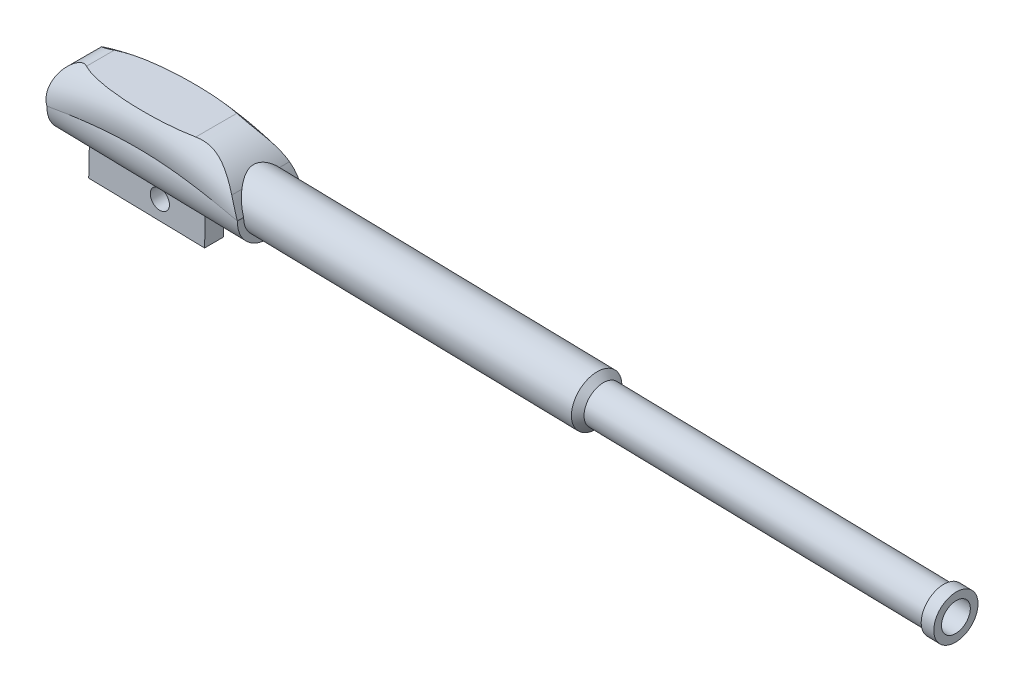
from build123d import *

# Parameters (mm, degrees)
SWEEP2_PROFILE_R                = 250
CUT_EXTRUDE4_DEPTH              = 21837.843425545
CUT_EXTRUDE4_DEPTH_BACK         = 21837.843425545
CUT_EXTRUDE5_START              = 4000
SKETCH746_W                     = 1580.957428518
SKETCH746_H                     = 556.011303815
CUT_EXTRUDE5_DEPTH              = 120
FILLET1_R                       = 420
FILLET2_R                       = 180
SKETCH747_R                     = 200
BOSS_EXTRUDE1_DEPTH             = 2600
BOSS_EXTRUDE1_DIRECTION_2_REACH = 11475.563
SKETCH748_R                     = 150
BOSS_EXTRUDE2_DEPTH             = 2800
CHAMFER1_SIZE                   = 50
SKETCH749_R                     = 175.4
BOSS_EXTRUDE3_DEPTH             = 50
SKETCH750_R                     = 114.44
CUT_EXTRUDE6_DEPTH              = 6700
SKETCH751_W                     = 919.206439652
SKETCH751_H                     = 150
BOSS_EXTRUDE4_DEPTH             = 500
SKETCH752_R                     = 76.2
CUT_EXTRUDE7_DEPTH              = 1000


with BuildPart() as part:
    # Sweep2: sweep along a curve in space
    with BuildLine() as sweep2_path:
        ThreePointArc((17093.275143099, 3588.503696836, 10293.52283326), (17851.77242231, 3723.652807046, 10293.52283326), (18603.521705639, 3554.962500336, 10293.52283326))
    # Sweep2 profile (on start of the path) → Sweep2 (sweep)
    with BuildSketch(Plane(origin=(17093.275143099, 3588.503696836, 10293.52283326), x_dir=(-0.36614653307750233, 0.9305572074382776, 0), z_dir=(0.9305572074382776, 0.36614653307750233, 1.851668958091752e-14))):
        Circle(SWEEP2_PROFILE_R)
    sweep(path=sweep2_path.line)

    # Sweep3: read off the stored shape, not the designer's step
    # Sweep3: loft between two sections, ruled curve by curve
    sweep3_from = [
        Edge.make_three_point_arc((17094.962189181, 3664.465672345, 10531.696996745), (17090.000399356, 3441.053069073, 10495.383152356), (17087.724240285, 3338.565329477, 10293.522833606)),
        Edge.make_three_point_arc((17087.724240285, 3338.565329477, 10293.522833606), (17090.000399344, 3441.053068514, 10091.662514572), (17094.962189167, 3664.465671685, 10055.348669563)),
        Edge.make_line((17094.962189167, 3664.465671685, 10055.348669563), (17094.962189181, 3664.465672345, 10531.696996745)),
    ]
    sweep3_to = [
        Edge.make_three_point_arc((18605.208751721, 3630.924475845, 10531.696996745), (18600.246961896, 3407.511872573, 10495.383152356), (18597.970802825, 3305.024132977, 10293.522833606)),
        Edge.make_three_point_arc((18597.970802825, 3305.024132977, 10293.522833606), (18600.246961884, 3407.511872014, 10091.662514572), (18605.208751706, 3630.924475185, 10055.348669563)),
        Edge.make_line((18605.208751706, 3630.924475185, 10055.348669563), (18605.208751721, 3630.924475845, 10531.696996745)),
    ]
    sweep3 = Solid(Shell([*[Face.make_surface_from_curves(sweep3_from[k], sweep3_to[k]) for k in range(3)], Face(Wire(sweep3_from)), Face(Wire(sweep3_to))]))
    add(sweep3)

    # Sketch745 → Cut-Extrude4 (cut, two sides: drawn at the far end of the back side and taken through both)
    with BuildSketch(Plane.XY.offset(-CUT_EXTRUDE4_DEPTH_BACK)):
        with BuildLine():
            ThreePointArc((18603.521705639, 3554.962500336), (18423.001238481, 3819.326000451), (18130.945992472, 3950.396334753))
            Line((18130.945992472, 3950.396334753), (18815.620204907, 3878.337148104))
            Line((18815.620204907, 3878.337148104), (18603.521705639, 3554.962500336))
        make_face()
        with BuildLine():
            ThreePointArc((17219.581520856, 3893.989750395), (17101.976693782, 3771.779138477), (17087.658554588, 3602.778192011))
            Line((17087.658554588, 3602.778192011), (16955.786908107, 3852.69924194))
            Line((16955.786908107, 3852.69924194), (17219.581520856, 3893.989750395))
        make_face()
    extrude(amount=CUT_EXTRUDE4_DEPTH + CUT_EXTRUDE4_DEPTH_BACK, mode=Mode.SUBTRACT)

    # Sketch746 → Cut-Extrude5 (cut)
    with BuildSketch(Plane(origin=(0, 0, 0), x_dir=(1, 0, 0), z_dir=(0, 1, 0)).offset(CUT_EXTRUDE5_START)):
        with Locations((17844.939807357, -10296.889638882)):
            Rectangle(SKETCH746_W, SKETCH746_H)
    extrude(amount=-CUT_EXTRUDE5_DEPTH, mode=Mode.SUBTRACT)

    # Fillet1
    fillet1_edges = [part.edges().sort_by_distance(p)[0] for p in [
        (18335.511227538, 3880, 10293.522833259),
    ]]
    fillet(fillet1_edges, radius=FILLET1_R)

    # Fillet2
    fillet2_edges = [part.edges().sort_by_distance(p)[0] for p in [
        (17195.110867242, 3880, 10293.52283326),
    ]]
    fillet(fillet2_edges, radius=FILLET2_R)

    # Sketch747 → Boss-Extrude1 (add)
    with BuildSketch(Plane(origin=(18515.436616901, -411.210932876, 0), x_dir=(0, 0, -1), z_dir=(0.9997534694350139, -0.0222036112525212, 0))):
        with Locations(Location((-10293.52283326, 3967.151457302, 0), (0, 0, 90))):
            Circle(SKETCH747_R)
    extrude(amount=BOSS_EXTRUDE1_DEPTH)

    # Sketch747 → Boss-Extrude1 direction 2 (add, up to next)
    with BuildSketch(Plane(origin=(18515.436616901, -411.210932876, 0), x_dir=(0, 0, -1), z_dir=(0.9997534694350139, -0.0222036112525212, 0)), mode=Mode.PRIVATE) as boss_extrude1_direction_2_sk1:
        with Locations(Location((-10293.52283326, 3967.151457302, 0), (0, 0, 90))):
            Circle(SKETCH747_R)
    boss_extrude1_direction_2_tool1 = extrude(boss_extrude1_direction_2_sk1.sketch, amount=-BOSS_EXTRUDE1_DIRECTION_2_REACH, mode=Mode.PRIVATE) - part.part
    add(boss_extrude1_direction_2_tool1.solids().sort_by_distance((18603.521706, 3554.9625, 10293.522833))[0])

    # Sketch748 → Boss-Extrude2 (add)
    with BuildSketch(Plane(origin=(21114.795637432, -468.940322133, 0), x_dir=(0, 0, -1), z_dir=(0.9997534694350139, -0.022203611252521207, 0))):
        with Locations(Location((-10293.52283326, 3967.151457302, 0), (0, 0, 90))):
            Circle(SKETCH748_R)
    extrude(amount=BOSS_EXTRUDE2_DEPTH)

    # Chamfer1
    chamfer1_edges = [part.edges().sort_by_distance(p)[0] for p in [
        (21199.550184482, 3347.270090664, 10293.52283326),
    ]]
    chamfer(chamfer1_edges, length=CHAMFER1_SIZE - 0.0001)  # a hair under: the kernel refuses the full size

    # Sketch749 → Boss-Extrude3 (add, symmetric)
    with BuildSketch(Plane(origin=(23914.10535185, -531.11043364, 0), x_dir=(0, 0, -1), z_dir=(0.9997534694350139, -0.022203611252521214, 0))):
        with Locations(Location((-10293.52283326, 3967.151457302, 0), (0, 0, 90))):
            Circle(SKETCH749_R)
    extrude(amount=BOSS_EXTRUDE3_DEPTH, both=True)

    # Sketch750 → Cut-Extrude6 (cut)
    with BuildSketch(Plane(origin=(23964.093025322, -532.220614202, 0), x_dir=(0, 0, -1), z_dir=(0.9997534694350139, -0.02220361125252122, 0))):
        with Locations(Location((-10293.52283326, 3967.151457302, 0), (0, 0, 90))):
            Circle(SKETCH750_R)
    extrude(amount=-CUT_EXTRUDE6_DEPTH, mode=Mode.SUBTRACT)

    # Sketch751 → Boss-Extrude4 (add)
    with BuildSketch(Plane(origin=(88.085088738, 3966.173433212, 0), x_dir=(0.9997534694350138, -0.022203611252521294, 0), z_dir=(0.022203611252521297, 0.9997534694350139, 0))):
        with Locations((17636.321703675, -10293.52283326)):
            Rectangle(SKETCH751_W, SKETCH751_H)
    extrude(amount=-BOSS_EXTRUDE4_DEPTH)

    # Sketch752 → Cut-Extrude7 (cut, symmetric)
    with BuildSketch(Plane(origin=(-51.559493702, 344.74369465, 9918.52283326), x_dir=(0.9998089396325288, -0.019546974980253765, 0), z_dir=(0, 0, 1))):
        with Locations(Location((17805.592859297, 3225.739791916, 0), (0, 0, 1.120030501))):
            Circle(SKETCH752_R)
    extrude(amount=CUT_EXTRUDE7_DEPTH, both=True, mode=Mode.SUBTRACT)


solid = part.part
